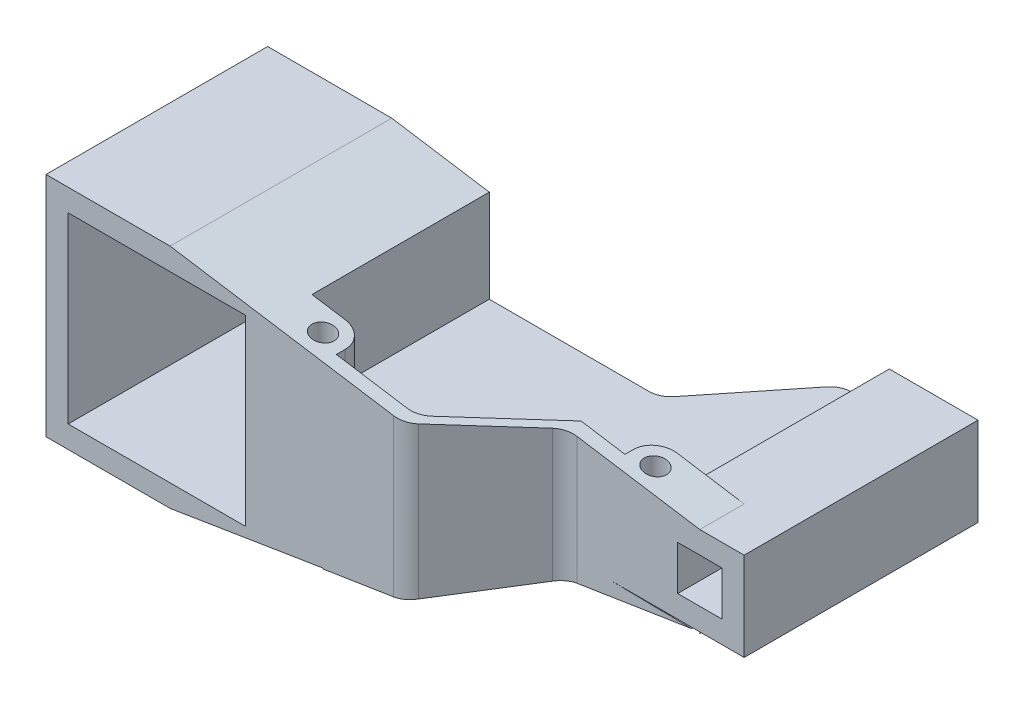
from build123d import *
from build123d.topology import SkipClean

# Parameters (mm, degrees)
ESQUISSE1_W                   = 80
ESQUISSE1_H                   = 82.5
BOSS_EXTRU_3_DEPTH            = 100
ESQUISSE2_W                   = 25
ESQUISSE2_H                   = 20
BOSS_EXTRU_4_DEPTH            = 102.5
ENL_V_MAT_EXTRU_1_DEPTH       = 169.324814886
ESQUISSE5_W                   = 25
ESQUISSE5_H                   = 5
BOSS_EXTRU_6_DEPTH            = 80
ESQUISSE6_R                   = 5
ENL_V_MAT_EXTRU_2_DEPTH       = 200.531778938
CONG_1_R                      = 10
BOSS_EXTRU_7_DEPTH            = 132
BOSS_EXTRU_7_DEPTH_BACK       = 156
ESQUISSE7_W                   = 40
ESQUISSE7_H                   = 40
ESQUISSE7_W_2                 = 20
ESQUISSE7_H_2                 = 20
ESQUISSE8_W                   = 56.966100386
ESQUISSE8_H                   = 72.151969112
ESQUISSE8_H_2                 = 40
ENL_V_MAT_EXTRU_3_DEPTH       = 233.699228203
ESQUISSE9_W                   = 40
ESQUISSE9_H                   = 86.5
ENL_V_MAT_EXTRU_4_DEPTH       = 205.46819632
ESQUISSE10_W                  = 20
ESQUISSE10_H                  = 20
BOSS_EXTRU_9_DEPTH            = 40
BOSS_EXTRU_10_REACH           = 209.614
ESQUISSE11_W                  = 20
ESQUISSE11_H                  = 5
BOSS_EXTRU_11_DEPTH           = 20
ESQUISSE14_R                  = 5
ENL_V_MAT_EXTRU_5_DEPTH       = 200.531778938
CONG_2_R                      = 10
CONG_3_R                      = 10
BOSS_EXTRU_30_DEPTH           = 102.5
ESQUISSE27_W                  = 37.951925993
ESQUISSE27_H                  = 112.382443636
BOSS_EXTRU_49_DEPTH           = 60
ENL_V_MAT_EXTRU_8_DEPTH       = 205.784019015
ESQUISSE29_W                  = 18.162926374
ESQUISSE29_H                  = 48.488335355
ENL_V_MAT_EXTRU_9_DEPTH       = 205.784019015
ENL_V_MAT_EXTRU_15_DEPTH      = 188.114342077
ENL_V_MAT_EXTRU_15_DEPTH_BACK = 104
ENL_V_MAT_EXTRU_25_DEPTH      = 202.764949791
ENL_V_MAT_EXTRU_33_DEPTH      = 157
ENL_V_MAT_EXTRU_34_DEPTH      = 157
BOSS_EXTRU_60_REACH           = 180.699
ESQUISSE48_W                  = 90
ESQUISSE48_H                  = 5
ESQUISSE49_W                  = 4.284374684
ESQUISSE49_H                  = 33.615862906
BOSS_EXTRU_61_DEPTH           = 5
BOSS_EXTRU_63_DEPTH           = 44
BOSS_EXTRU_63_DEPTH_BACK      = 17.5
ENL_V_MAT_EXTRU_35_DEPTH      = 212.123022919
CONG_5_START                  = 2.5
CONG_5_DEPTH                  = 48.75
BOSS_EXTRU_70_DEPTH           = 15.5
CONG_6_R                      = 10
ESQUISSE70_W                  = 13.324534179
ESQUISSE70_H                  = 11.766054646
BOSS_EXTRU_72_DEPTH           = 5
ESQUISSE71_W                  = 4.931981982
ESQUISSE71_H                  = 11.766054646
BOSS_EXTRU_73_DEPTH           = 15
CONG_7_R                      = 10
ENL_V_MAT_EXTRU_36_DEPTH      = 208.613808082
BOSS_EXTRU_74_REACH           = 209.614
ESQUISSE75_W                  = 50.566617397
ESQUISSE75_H                  = 5
ENL_V_MAT_EXTRU_37_DEPTH      = 180.431723244
ENL_V_MAT_EXTRU_37_DEPTH_BACK = 60
CONG_8_R                      = 10


with BuildPart() as part:
    # Esquisse1 → Boss.-Extru.3 (new body)
    with BuildSketch(Plane.XY):
        Polygon((-138.948482562, -51.25), (-82.948482562, -51.25), (-38.948482562, -44.340452261), (-38.948482562, 44.340452261), (-82.948482562, 51.25), (-138.948482562, 51.25), align=None)
        with Locations((-88.948482562, 0)):
            Rectangle(ESQUISSE1_W, ESQUISSE1_H, mode=Mode.SUBTRACT)
    extrude(amount=BOSS_EXTRU_3_DEPTH)

    # Esquisse2 → Boss.-Extru.4 (add, through all)
    with BuildSketch(Plane(origin=(0, 51.25, 0), x_dir=(1, 0, 0), z_dir=(0, 1, 0))):
        with Locations((-26.448482562, -90)):
            Rectangle(ESQUISSE2_W, ESQUISSE2_H)
    extrude(amount=-BOSS_EXTRU_4_DEPTH)

    # Esquisse4 → Enlèv. mat.-Extru.1 (cut, through all)
    with BuildSketch(Plane(origin=(0, 0, 80), x_dir=(-1, 0, 0), z_dir=(0, 0, -1))):
        Polygon((82.948482562, 51.25), (7.101445633, 39.733012599), (13.461078658, 66.038767386), (82.948482562, 62.280802417), align=None)
        Polygon((82.948482562, -51.25), (-9.375785388, -36.29350948), (26.758493166, -73.584084948), align=None)
    extrude(amount=-ENL_V_MAT_EXTRU_1_DEPTH, mode=Mode.SUBTRACT)

    # Esquisse5 → Boss.-Extru.6 (add)
    with BuildSketch(Plane(origin=(0, 0, 80), x_dir=(-1, 0, 0), z_dir=(0, 0, -1))):
        with Locations((26.448482562, 0)):
            Rectangle(ESQUISSE5_W, ESQUISSE5_H)
    extrude(amount=BOSS_EXTRU_6_DEPTH)

    # Esquisse6 → Enlèv. mat.-Extru.2 (cut, through all)
    with BuildSketch(Plane(origin=(0, 51.25, 0), x_dir=(1, 0, 0), z_dir=(0, 1, 0))):
        with Locations(Location((-23.948482562, -90, 0), (0, 0, 180))):
            Circle(ESQUISSE6_R)
    extrude(amount=-ENL_V_MAT_EXTRU_2_DEPTH, mode=Mode.SUBTRACT)

    # Congé1
    cong_1_edges = [part.edges().sort_by_distance(p)[0] for p in [
        (-13.948482562, -21.286015279, 80),
        (-13.948482562, 21.636350193, 80),
    ]]
    fillet(cong_1_edges, radius=CONG_1_R)

    # Esquisse21 → Boss.-Extru.30 (add, through all)
    with BuildSketch(Plane(origin=(0, 51.25, 0), x_dir=(1, 0, 0), z_dir=(0, 1, 0))):
        with BuildLine():
            Line((40.768208739, -72.213938048), (25.484900041, -90.427876097))
            ThreePointArc((25.484900041, -90.427876097), (22.050638227, -93.06307787), (17.824455609, -94))
            Line((17.824455609, -94), (13.584684534, -94))
            Line((13.584684534, -94), (-13.948482562, -94))
            Line((-13.948482562, -94), (-13.948482562, -97))
            Line((-13.948482562, -97), (-13.948482562, -100))
            Line((-13.948482562, -100), (17.824455609, -100))
            ThreePointArc((17.824455609, -100), (22.050638227, -99.06307787), (25.484900041, -96.427876097))
            Line((25.484900041, -96.427876097), (43.69734513, -74.723129231))
            Line((43.69734513, -74.723129231), (40.768208739, -72.213938048))
        make_face()
    extrude(amount=-BOSS_EXTRU_30_DEPTH)



with BuildPart() as body_2:
    # Esquisse7 → Boss.-Extru.7 (new, two sides: drawn at the far end of the back side and taken through both)
    with BuildSketch(Plane(origin=(0, 0, 0), x_dir=(-1, 0, 0), z_dir=(0, 0, -1)).offset(-BOSS_EXTRU_7_DEPTH_BACK)):
        with Locations((-116.051517438, 0)):
            Rectangle(ESQUISSE7_W, ESQUISSE7_H)
        with Locations((-116.051517438, 0)):
            Rectangle(ESQUISSE7_W_2, ESQUISSE7_H_2, mode=Mode.SUBTRACT)
    extrude(amount=BOSS_EXTRU_7_DEPTH + BOSS_EXTRU_7_DEPTH_BACK)

    # Esquisse8 → Enlèv. mat.-Extru.3 (cut, through all)
    with BuildSketch(Plane(origin=(0, 51.25, 0), x_dir=(1, 0, 0), z_dir=(0, 1, 0))):
        with Locations((124.534567631, -136.075984556)):
            Rectangle(ESQUISSE8_W, ESQUISSE8_H)
        with Locations((124.534567631, -80)):
            Rectangle(ESQUISSE8_W, ESQUISSE8_H_2)
    extrude(amount=-ENL_V_MAT_EXTRU_3_DEPTH, mode=Mode.SUBTRACT)

    # Esquisse9 → Enlèv. mat.-Extru.4 (cut, through all)
    with BuildSketch(Plane(origin=(0, 20, 0), x_dir=(1, 0, 0), z_dir=(0, 1, 0))):
        with Locations((116.051517438, 88.75)):
            Rectangle(ESQUISSE9_W, ESQUISSE9_H)
    extrude(amount=-ENL_V_MAT_EXTRU_4_DEPTH, mode=Mode.SUBTRACT)

    # Esquisse10 → Boss.-Extru.9 (add)
    with BuildSketch(Plane(origin=(0, 20, 0), x_dir=(1, 0, 0), z_dir=(0, 1, 0))):
        with Locations((86.051517438, -50)):
            Rectangle(ESQUISSE10_W, ESQUISSE10_H)
    extrude(amount=-BOSS_EXTRU_9_DEPTH)

    # Esquisse11 → Boss.-Extru.10 (add, up to next)
    with BuildSketch(Plane(origin=(0, 0, -45.5), x_dir=(-1, 0, 0), z_dir=(0, 0, -1)), mode=Mode.PRIVATE) as boss_extru_10_sk1:
        with Locations((-86.051517438, 0)):
            Rectangle(ESQUISSE11_W, ESQUISSE11_H)
    boss_extru_10_tool1 = extrude(boss_extru_10_sk1.sketch, amount=-BOSS_EXTRU_10_REACH, mode=Mode.PRIVATE) - body_2.part
    add(boss_extru_10_tool1.solids().sort_by_distance((86.051517, 0, -45.5))[0])

    # Esquisse13 → Boss.-Extru.11 (add)
    with BuildSketch(Plane.XY.offset(60)):
        Polygon((116.051517438, 20), (76.051517438, 26.281407035), (76.051517438, 20), align=None)
        Polygon((116.051517438, -20.626903689), (76.051517438, -20), (75.510830831, -26.86550344), align=None)
    extrude(amount=-BOSS_EXTRU_11_DEPTH)


with BuildPart() as boss_extru_11_piece_1:
    # of the separate pieces the step leaves, piece 1, a body of its own (boss_extru_11_pieces)
    add(body_2.part.solids().sort_by_distance((136.051517438, -20, 60))[0])


with BuildPart() as boss_extru_11_piece_2:
    # of the separate pieces the step leaves, piece 2, a body of its own (boss_extru_11_pieces)
    add(body_2.part.solids().sort_by_distance((116.051517438, -20.626903689, 60))[0])


with BuildPart() as enl_v_mat_extru_5_tool:
    # Esquisse14 → Enlèv. mat.-Extru.5 (new, through all)
    with BuildSketch(Plane(origin=(0, 51.25, 0), x_dir=(1, 0, 0), z_dir=(0, 1, 0))):
        with Locations((86.051517438, -50)):
            Circle(ESQUISSE14_R)
    extrude(amount=-ENL_V_MAT_EXTRU_5_DEPTH)


with BuildPart() as boss_extru_11_piece_1_1:
    add(boss_extru_11_piece_1.part)

    # Enlèv. mat.-Extru.5: cut by enl_v_mat_extru_5_tool
    add(enl_v_mat_extru_5_tool.part, mode=Mode.SUBTRACT)

    # Congé2
    cong_2_edges = [boss_extru_11_piece_1_1.edges().sort_by_distance(p)[0] for p in [
        (76.051517438, -11.25, 40),
        (76.051517438, 14.390703518, 40),
    ]]
    fillet(cong_2_edges, radius=CONG_2_R)


with BuildPart() as boss_extru_11_piece_2_1:
    add(boss_extru_11_piece_2.part)

    # Enlèv. mat.-Extru.5: cut by enl_v_mat_extru_5_tool
    add(enl_v_mat_extru_5_tool.part, mode=Mode.SUBTRACT)

    # Congé3
    cong_3_edges = [boss_extru_11_piece_2_1.edges().sort_by_distance(p)[0] for p in [
        (75.781174135, -23.43275172, 40),
    ]]
    fillet(cong_3_edges, radius=CONG_3_R)


with BuildPart() as part_1:
    add(part.part)

    add(boss_extru_11_piece_1_1.part)  # Boss.-Extru.49 merges Boss.-Extru.11 piece 1

    add(boss_extru_11_piece_2_1.part)  # Boss.-Extru.49 merges Boss.-Extru.11 piece 2
    # Esquisse27 → Boss.-Extru.49 (add, through all)
    with BuildSketch(Plane(origin=(0, 0, 40), x_dir=(-1, 0, 0), z_dir=(0, 0, -1))):
        with Locations((-57.075554442, -0.659134567)):
            Rectangle(ESQUISSE27_W, ESQUISSE27_H)
    extrude(amount=-BOSS_EXTRU_49_DEPTH)

    # Esquisse28 → Enlèv. mat.-Extru.8 (cut, through all)
    with BuildSketch(Plane(origin=(0, 55.532087251, 0), x_dir=(1, 0, 0), z_dir=(0, 1, 0))):
        with BuildLine():
            ThreePointArc((60.71459402, -60), (56.488411402, -60.93692213), (53.054149588, -63.572123903))
            Line((53.054149588, -63.572123903), (38.099591445, -81.394272297))
            Line((38.099591445, -81.394272297), (38.099591445, -100))
            Line((38.099591445, -100), (76.006099273, -100))
            Line((76.006099273, -100), (76.051517438, -60))
            Line((76.051517438, -60), (60.71459402, -60))
        make_face()
    extrude(amount=-ENL_V_MAT_EXTRU_8_DEPTH, mode=Mode.SUBTRACT)


with BuildPart() as enl_v_mat_extru_8_piece_1:
    # of the separate pieces the step leaves, piece 1, a body of its own (enl_v_mat_extru_8_pieces)
    add(part_1.part.solids().sort_by_distance((86.070114786, -20.157017391, 40))[0])

    # Esquisse33 → Enlèv. mat.-Extru.15 (cut, two sides: drawn at the far end of the back side and taken through both)
    with BuildSketch(Plane.XZ.offset(20).offset(-ENL_V_MAT_EXTRU_15_DEPTH_BACK)):
        Polygon((27.047173314, 88.566031311), (73.834674686, 32.806858462), (27.047173314, 32.806858462), align=None)
    extrude(amount=ENL_V_MAT_EXTRU_15_DEPTH + ENL_V_MAT_EXTRU_15_DEPTH_BACK, mode=Mode.SUBTRACT)

    # Esquisse36 → Enlèv. mat.-Extru.25 (cut, through all)
    with BuildSketch(Plane.XZ.offset(51.25)):
        Polygon((79.625069152, 53.780166313), (51.611850064, 53.780166313), (51.611850064, 28.403485492), (51.611850064, 26.096514508), (51.611850064, 20.164303407), (79.625069152, 20.164303407), align=None)
    extrude(amount=-ENL_V_MAT_EXTRU_25_DEPTH, mode=Mode.SUBTRACT)

    # Esquisse46 → Enlèv. mat.-Extru.33 (cut)
    with BuildSketch(Plane(origin=(0, 0, -45.5), x_dir=(-1, 0, 0), z_dir=(0, 0, -1))):
        Polygon((-116.051517438, 20), (82.948482562, 51.25), (-79.954636435, 76.953960671), align=None)
    extrude(amount=-ENL_V_MAT_EXTRU_33_DEPTH, mode=Mode.SUBTRACT)

    # Esquisse47 → Enlèv. mat.-Extru.34 (cut)
    with BuildSketch(Plane(origin=(0, 0, -45.5), x_dir=(-1, 0, 0), z_dir=(0, 0, -1))):
        Polygon((-82.644960183, -25.767668615), (82.948482562, -51.25), (-105.331317256, -68.548851228), align=None)
    extrude(amount=-ENL_V_MAT_EXTRU_34_DEPTH, mode=Mode.SUBTRACT)

    # Esquisse48 → Boss.-Extru.60 (add, up to next)
    with BuildSketch(Plane(origin=(0, 0, 0), x_dir=(-1, 0, 0), z_dir=(0, 0, -1)), mode=Mode.PRIVATE) as boss_extru_60_sk1:
        with Locations((-31.051517438, 0)):
            Rectangle(ESQUISSE48_W, ESQUISSE48_H)
    boss_extru_60_tool1 = extrude(boss_extru_60_sk1.sketch, amount=-BOSS_EXTRU_60_REACH, mode=Mode.PRIVATE) - enl_v_mat_extru_8_piece_1.part
    add(boss_extru_60_tool1.solids().sort_by_distance((31.051517, 0, 0))[0])

    # Esquisse49 → Boss.-Extru.61 (add)
    with SkipClean():  # the faces are left unmerged after this step: merging them gives an invalid solid
        with BuildSketch(Plane.XZ.offset(2.5)):
            with Locations((77.48288181, 36.97223486)):
                Rectangle(ESQUISSE49_W, ESQUISSE49_H)
        extrude(amount=-BOSS_EXTRU_61_DEPTH)

    # Esquisse51 → Boss.-Extru.63 (add, two sides: drawn at the far end of the back side and taken through both)
    with BuildSketch(Plane(origin=(0, 20, 0), x_dir=(1, 0, 0), z_dir=(0, 1, 0)).offset(-BOSS_EXTRU_63_DEPTH_BACK)):
        Polygon((76.051517438, -40), (76.051517438, -53.780166313), (79.625069152, -53.780166313), (79.625069152, -42.33835772), (86.051517438, -42.33835772), (86.051517438, -40), align=None)
    extrude(amount=BOSS_EXTRU_63_DEPTH + BOSS_EXTRU_63_DEPTH_BACK)

    # Esquisse53 → Enlèv. mat.-Extru.35 (cut, through all)
    with BuildSketch(Plane.XY.offset(100)):
        Polygon((-80.095816123, 50.802031024), (116.051517438, 20), (116.051517438, 87.283768072), (-75.409684876, 80.643314802), align=None)
    extrude(amount=-ENL_V_MAT_EXTRU_35_DEPTH, mode=Mode.SUBTRACT)

    # Congé5: read off the stored shape, not the designer's step
    # Congé5 outline → Congé5 (cut)
    with BuildSketch(Plane(origin=(0, 0, 0), x_dir=(1, 0, 0), z_dir=(0, 1, 0)).offset(CONG_5_START)):
        with BuildLine():
            ThreePointArc((76.051517438, -50), (78.980449626, -42.928932188), (86.051517438, -40))
            Line((86.051517438, -40), (76.051517438, -40))
            Line((76.051517438, -40), (76.051517438, -50))
        make_face()
    extrude(amount=CONG_5_DEPTH, mode=Mode.SUBTRACT)

    # Esquisse68 → Boss.-Extru.70 (add)
    with BuildSketch(Plane.XZ.offset(2.5)):
        Polygon((76.051517438, 53.780166313), (76.051517438, 40), (91.051517438, 40), (79.625069152, 44.222715095), (79.625069152, 53.780166313), align=None)
    extrude(amount=BOSS_EXTRU_70_DEPTH)

    # Congé6
    cong_6_edges = [enl_v_mat_extru_8_piece_1.edges().sort_by_distance(p)[0] for p in [
        (76.051517438, -10.25, 40),
    ]]
    fillet(cong_6_edges, radius=CONG_6_R - 0.0001)  # a hair under: the kernel refuses the full size

    # Esquisse70 → Boss.-Extru.72 (add)
    with BuildSketch(Plane(origin=(0, 0, 40), x_dir=(-1, 0, 0), z_dir=(0, 0, -1))):
        with Locations((-82.849820564, -20.878338717)):
            Rectangle(ESQUISSE70_W, ESQUISSE70_H)
    extrude(amount=-BOSS_EXTRU_72_DEPTH)

    # Esquisse71 → Boss.-Extru.73 (add)
    with BuildSketch(Plane(origin=(0, 0, 40), x_dir=(-1, 0, 0), z_dir=(0, 0, -1))):
        with Locations((-78.653544465, -20.878338717)):
            Rectangle(ESQUISSE71_W, ESQUISSE71_H)
    extrude(amount=-BOSS_EXTRU_73_DEPTH)

    # Congé7
    # the kernel refuses this fillet: 10 mm, written as the material it takes off along each edge
    with BuildSketch(Plane(origin=(76.187553474, 10.004688606, 40), x_dir=(1, 0, 0), z_dir=(0, -1, 0))) as cong_7_piece_1_section:
        with BuildLine():
            CenterArc((CONG_7_R, CONG_7_R), CONG_7_R, 180, 90)
            Line((0, CONG_7_R), (0, 0))
            Line((0, 0), (CONG_7_R, 0))
        make_face()
    cong_7_piece_1 = extrude(amount=61.766054646, mode=Mode.PRIVATE)
    cong_7_piece_1 = cong_7_piece_1 - Plane(origin=(86.051517438, 10.004688606, 50), x_dir=(-1.0, 0, 4.5931614069849837e-11), z_dir=(0, -1, 0)) * Cylinder(10, 164, mode=Mode.PRIVATE)
    cong_7_piece_1 = split(cong_7_piece_1, bisect_by=Plane(origin=(76.187553474, -2.5, 40), z_dir=(0, -1, 0)), keep=Keep.TOP, mode=Mode.PRIVATE)
    add(cong_7_piece_1, mode=Mode.SUBTRACT)
    with BuildSketch(Plane(origin=(76.187553474, 10.004688606, 40), x_dir=(1, 0, 0), z_dir=(0, -1, 0))) as cong_7_piece_2_section:
        with BuildLine():
            CenterArc((CONG_7_R, CONG_7_R), CONG_7_R, 180, 90)
            Line((0, CONG_7_R), (0, 0))
            Line((0, 0), (CONG_7_R, 0))
        make_face()
    cong_7_piece_2 = extrude(amount=61.766054646, mode=Mode.PRIVATE)
    cong_7_piece_2 = split(cong_7_piece_2, bisect_by=Plane(origin=(76.187553474, -18, 40), z_dir=(0, -1, 0)), keep=Keep.TOP, mode=Mode.PRIVATE)
    add(cong_7_piece_2, mode=Mode.SUBTRACT)

    # Esquisse73 → Enlèv. mat.-Extru.36 (cut, through all)
    with BuildSketch(Plane(origin=(0, 0, -45.5), x_dir=(-1, 0, 0), z_dir=(0, 0, -1))):
        Polygon((-116.051517438, -20), (82.948482562, -51.25), (-108.62699009, -51.25), align=None)
    extrude(amount=-ENL_V_MAT_EXTRU_36_DEPTH, mode=Mode.SUBTRACT)


with BuildPart() as enl_v_mat_extru_8_piece_2:
    # of the separate pieces the step leaves, piece 2, a body of its own (enl_v_mat_extru_8_pieces)
    add(part_1.part.solids().sort_by_distance((76.051517438, 55.532087251, 100))[0])

    # Esquisse29 → Enlèv. mat.-Extru.9 (cut, through all)
    with BuildSketch(Plane(origin=(0, 55.532087251, 0), x_dir=(1, 0, 0), z_dir=(0, 1, 0))):
        with Locations((77.464518916, -84.244167678)):
            Rectangle(ESQUISSE29_W, ESQUISSE29_H)
    extrude(amount=-ENL_V_MAT_EXTRU_9_DEPTH, mode=Mode.SUBTRACT)


with BuildPart() as enl_v_mat_extru_36_piece_1:
    # of the separate pieces the step leaves, piece 1, a body of its own (enl_v_mat_extru_36_pieces)
    add(enl_v_mat_extru_8_piece_1.part.solids().sort_by_distance((86.051417438, -2.5, 40))[0])

    # Esquisse75 → Boss.-Extru.74 (add, up to next)
    with BuildSketch(Plane(origin=(0, 0, -45.5), x_dir=(-1, 0, 0), z_dir=(0, 0, -1)), mode=Mode.PRIVATE) as boss_extru_74_sk1:
        with Locations((-50.76820874, 0)):
            Rectangle(ESQUISSE75_W, ESQUISSE75_H)
    boss_extru_74_tool1 = extrude(boss_extru_74_sk1.sketch, amount=-BOSS_EXTRU_74_REACH, mode=Mode.PRIVATE) - enl_v_mat_extru_36_piece_1.part
    add(boss_extru_74_tool1.solids().sort_by_distance((50.768209, 0, -45.5))[0])

    # Esquisse76 → Enlèv. mat.-Extru.37 (cut, two sides: drawn at the far end of the back side and taken through both)
    with BuildSketch(Plane(origin=(0, 2.5, 0), x_dir=(1, 0, 0), z_dir=(0, 1, 0)).offset(-ENL_V_MAT_EXTRU_37_DEPTH_BACK)):
        with BuildLine():
            Line((40.914809763, 3.753049524), (74.971252324, 46.323602726))
            Line((74.971252324, 46.323602726), (25.484900041, 45.5))
            Line((25.484900041, 45.5), (25.484900041, 0))
            Line((25.484900041, 0), (33.106121669, 0))
            ThreePointArc((33.106121669, 0), (37.438008974, 0.986967637), (40.914809763, 3.753049524))
        make_face()
    extrude(amount=ENL_V_MAT_EXTRU_37_DEPTH + ENL_V_MAT_EXTRU_37_DEPTH_BACK, mode=Mode.SUBTRACT)

    # Congé8
    cong_8_edges = [enl_v_mat_extru_36_piece_1.edges().sort_by_distance(p)[0] for p in [
        (74.312370144, 0, -45.5),
    ]]
    fillet(cong_8_edges, radius=CONG_8_R)


with BuildPart() as enl_v_mat_extru_36_piece_2:
    # of the separate pieces the step leaves, piece 2, a body of its own (enl_v_mat_extru_36_pieces)
    add(enl_v_mat_extru_8_piece_1.part.solids().sort_by_distance((116.051517438, -20.626903689, 40))[0])


solid = Compound([enl_v_mat_extru_36_piece_1.part, enl_v_mat_extru_36_piece_2.part])
